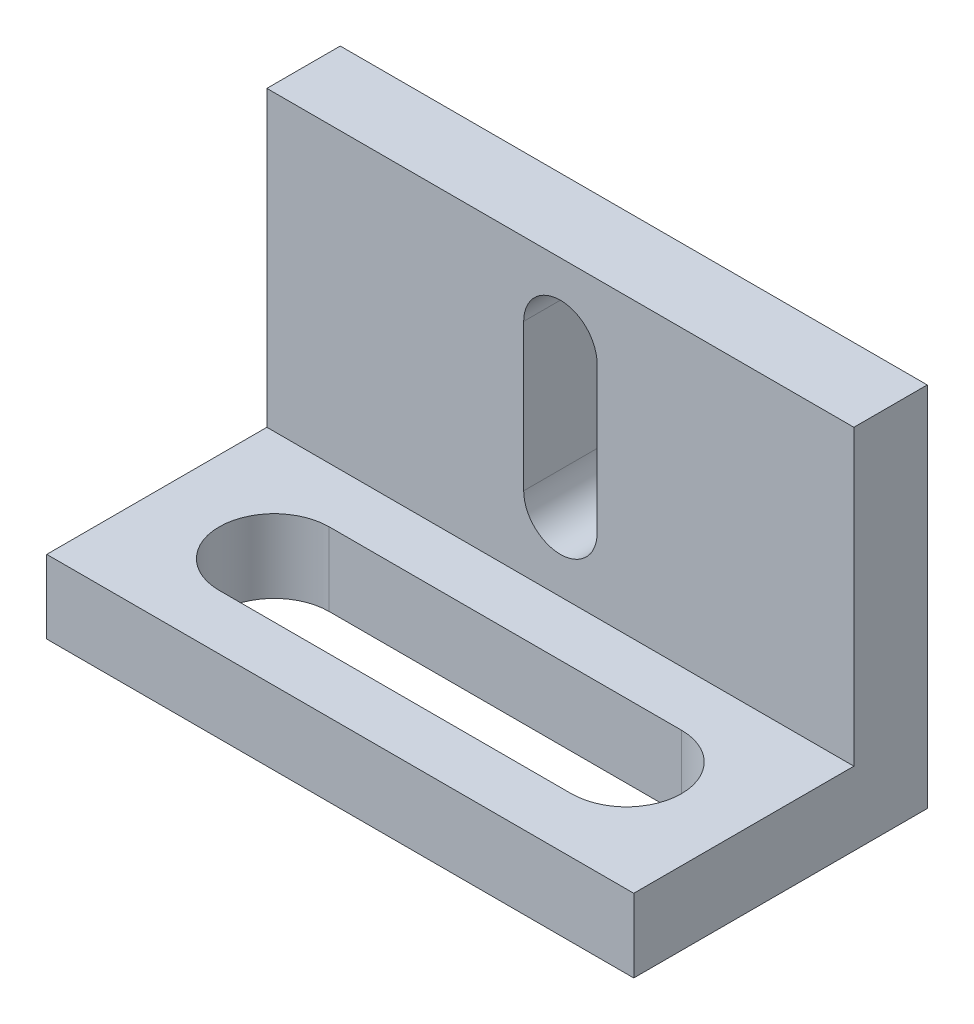
from build123d import *

# Parameters (mm, degrees)
SKETCH1_W           = 25.4
SKETCH1_H           = 12.7
BOSS_EXTRUDE1_DEPTH = 3.175
SKETCH2_W           = 25.4
SKETCH2_H           = 3.175
BOSS_EXTRUDE2_DEPTH = 12.7
CUT_EXTRUDE1_DEPTH  = 23.450640303
CUT_EXTRUDE2_DEPTH  = 20.05


with BuildPart() as part:
    # Sketch1 → Boss-Extrude1 (new body)
    with BuildSketch(Plane(origin=(0, 0, 0), x_dir=(1, 0, 0), z_dir=(0, 1, 0))):
        Rectangle(SKETCH1_W, SKETCH1_H)
    extrude(amount=BOSS_EXTRUDE1_DEPTH)

    # Sketch2 → Boss-Extrude2 (add)
    with BuildSketch(Plane(origin=(0, 3.175, 0), x_dir=(1, 0, 0), z_dir=(0, 1, 0))):
        with Locations((0, 4.7625)):
            Rectangle(SKETCH2_W, SKETCH2_H)
    extrude(amount=BOSS_EXTRUDE2_DEPTH)

    # Sketch3 → Cut-Extrude1 (cut, through all)
    with BuildSketch(Plane.XY.offset(-3.175)):
        with BuildLine():
            Line((1.5875, 12.7), (1.5875, 6.35))
            ThreePointArc((1.5875, 6.35), (0, 4.7625), (-1.5875, 6.35))
            Line((-1.5875, 6.35), (-1.5875, 12.7))
            ThreePointArc((-1.5875, 12.7), (0, 14.2875), (1.5875, 12.7))
        make_face()
    extrude(amount=-CUT_EXTRUDE1_DEPTH, mode=Mode.SUBTRACT)

    # Sketch4 → Cut-Extrude2 (cut, through all)
    with BuildSketch(Plane(origin=(0, 3.175, 0), x_dir=(1, 0, 0), z_dir=(0, 1, 0))):
        with BuildLine():
            Line((-7.62, 0.79375), (7.62, 0.79375))
            ThreePointArc((7.62, 0.79375), (10.00125, -1.5875), (7.62, -3.96875))
            Line((7.62, -3.96875), (-7.62, -3.96875))
            ThreePointArc((-7.62, -3.96875), (-10.00125, -1.5875), (-7.62, 0.79375))
        make_face()
    extrude(amount=-CUT_EXTRUDE2_DEPTH, mode=Mode.SUBTRACT)


solid = part.part
